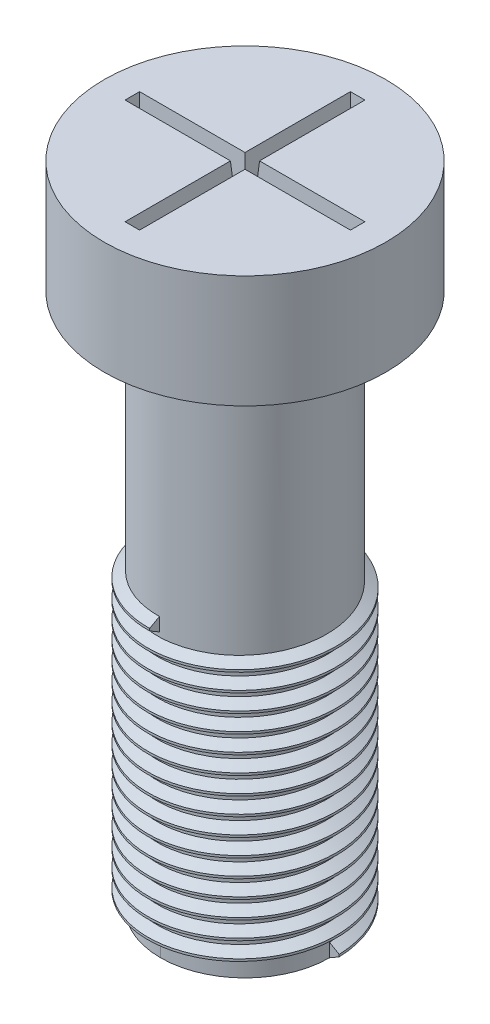
from build123d import *
from build123d.topology import SkipClean

# Parameters (mm, degrees)
CUT_EXTRUDE1_DEPTH = 0.5
CUT_EXTRUDE1_DRAFT = -4
THREAD1_PITCH      = 0.3175


with BuildPart() as part:
    # Sketch1 → Revolve1 (revolve)
    with BuildSketch(Plane.XY, mode=Mode.PRIVATE) as revolve1_sk:
        Polygon((0, -8.777027027), (-1.5, -8.777027027), (-1.5, 0.722972973), (-2.5, 0.722972973), (-2.5, 2.722972973), (0, 2.722972973), align=None)
    revolve(revolve1_sk.sketch.rotate(Axis((0, 6.506756757, 0), (0, -1, 0)), 270), axis=Axis((0, 6.506756757, 0), (0, -1, 0)))


with BuildPart() as cut_extrude1_tool:
    # Sketch2 → Cut-Extrude1 (with draft: the straight prism first)
    with BuildSketch(Plane(origin=(0, 2.722972973, 0), x_dir=(1, 0, 0), z_dir=(0, 1, 0))):
        Polygon((2, -0.129018168), (2, 0.129018168), (0.129018168, 0.129018168), (0.129018168, 2), (-0.129018168, 2), (-0.129018168, 0.129018168), (-2, 0.129018168), (-2, -0.129018168), (-0.129018168, -0.129018168), (-0.129018168, -2), (0.129018168, -2), (0.129018168, -0.129018168), align=None)
    extrude(amount=-CUT_EXTRUDE1_DEPTH)
    # Cut-Extrude1: the draft: its side faces are tilted about the plane it starts from
    cut_extrude1_sides = [cut_extrude1_tool.faces().sort_by_distance(p)[0] for p in [
        (2, 2.472972973, 0),
        (1.064509084, 2.472972973, -0.129018168),
        (0.129018168, 2.472972973, -1.064509084),
        (0, 2.472972973, -2),
        (-0.129018168, 2.472972973, -1.064509084),
        (-1.064509084, 2.472972973, -0.129018168),
        (-2, 2.472972973, 0),
        (-1.064509084, 2.472972973, 0.129018168),
        (-0.129018168, 2.472972973, 1.064509084),
        (0, 2.472972973, 2),
        (0.129018168, 2.472972973, 1.064509084),
        (1.064509084, 2.472972973, 0.129018168),
    ]]
    draft(cut_extrude1_sides, Plane(origin=(0, 2.722972973, 0), x_dir=(1, 0, 0), z_dir=(0, 1, 0)), CUT_EXTRUDE1_DRAFT)


with BuildPart() as part_1:
    add(part.part)

    # Cut-Extrude1: cut by cut_extrude1_tool
    add(cut_extrude1_tool.part, mode=Mode.SUBTRACT)

    # Thread1: the profile of Thread Profile1 profile screwed along a right-hand helix of 15.748031 turns, 6 arcs to a turn; built about Z, then put on its axis
    with SkipClean():  # the faces are left unmerged after this step: merging them gives an invalid solid
        thread1_z = Axis((0, 0, 0), (0, 0, 1))
        thread1_corners = [(1.4997, 0, -0.000173205), (1.671851915, 0, 0.09921875), (1.671851915, 0, 0.13890625), (1.4997, 0, 0.238298204)]
        with BuildLine(mode=Mode.PRIVATE) as thread1_profile:
            Line(thread1_corners[0], thread1_corners[1])
            Line(thread1_corners[1], thread1_corners[2])
            Line(thread1_corners[2], thread1_corners[3])
            Line(thread1_corners[3], thread1_corners[0])
        thread1_cap = Face(thread1_profile.wire())
        thread1_turn_angles = [0, 30, 60, 90, 120, 150, 180, 210, 240, 270, 300, 330, 360]
        thread1_turn_weights = [1, 0.8660254037844387, 1, 0.8660254037844387, 1, 0.8660254037844387, 1, 0.8660254037844387, 1, 0.8660254037844387, 1, 0.8660254037844387, 1]
        thread1_turn_rails = [Edge.make_bspline([Vector(p[0], p[1], 0).rotate(thread1_z, thread1_turn_angles[k]) / thread1_turn_weights[k] + Vector(0, 0, p[2] + THREAD1_PITCH * thread1_turn_angles[k] / 360) for k in range(13)], [0, 0, 0, 1, 1, 2, 2, 3, 3, 4, 4, 5, 5, 6, 6, 6], 2, thread1_turn_weights) for p in thread1_corners]
        thread1_turn_sides = [Face.make_surface_from_curves(thread1_turn_rails[p[0]], thread1_turn_rails[p[1]]) for p in [(0, 1), (1, 2), (2, 3), (3, 0)]]
        thread1_last_angles = [5400, 5430, 5460, 5490, 5520, 5550, 5580, 5610, 5640, 5654.645669291, 5669.291338583]
        thread1_last_weights = [1, 0.8660254037844387, 1, 0.8660254037844387, 1, 0.8660254037844387, 1, 0.8660254037844387, 1, 0.9675079437748956, 1]
        thread1_last_rails = [Edge.make_bspline([Vector(p[0], p[1], 0).rotate(thread1_z, thread1_last_angles[k]) / thread1_last_weights[k] + Vector(0, 0, p[2] + THREAD1_PITCH * thread1_last_angles[k] / 360) for k in range(11)], [0, 0, 0, 1, 1, 2, 2, 3, 3, 4, 4, 5, 5, 5], 2, thread1_last_weights) for p in thread1_corners]
        thread1_last_sides = [Face.make_surface_from_curves(thread1_last_rails[p[0]], thread1_last_rails[p[1]]) for p in [(0, 1), (1, 2), (2, 3), (3, 0)]]
        thread1 = Plane(origin=(0, -8.777027027, 0), x_dir=(1, 0, 0), z_dir=(0, 1, 0)) * Solid(Shell([*[p.moved(Location((0, 0, THREAD1_PITCH * i))) for i in range(15) for p in thread1_turn_sides], *thread1_last_sides, thread1_cap, thread1_cap.rotate(thread1_z, 5669.291338583).moved(Location((0, 0, THREAD1_PITCH * 5669.291338583 / 360)))]))
        add(thread1)


solid = part_1.part
